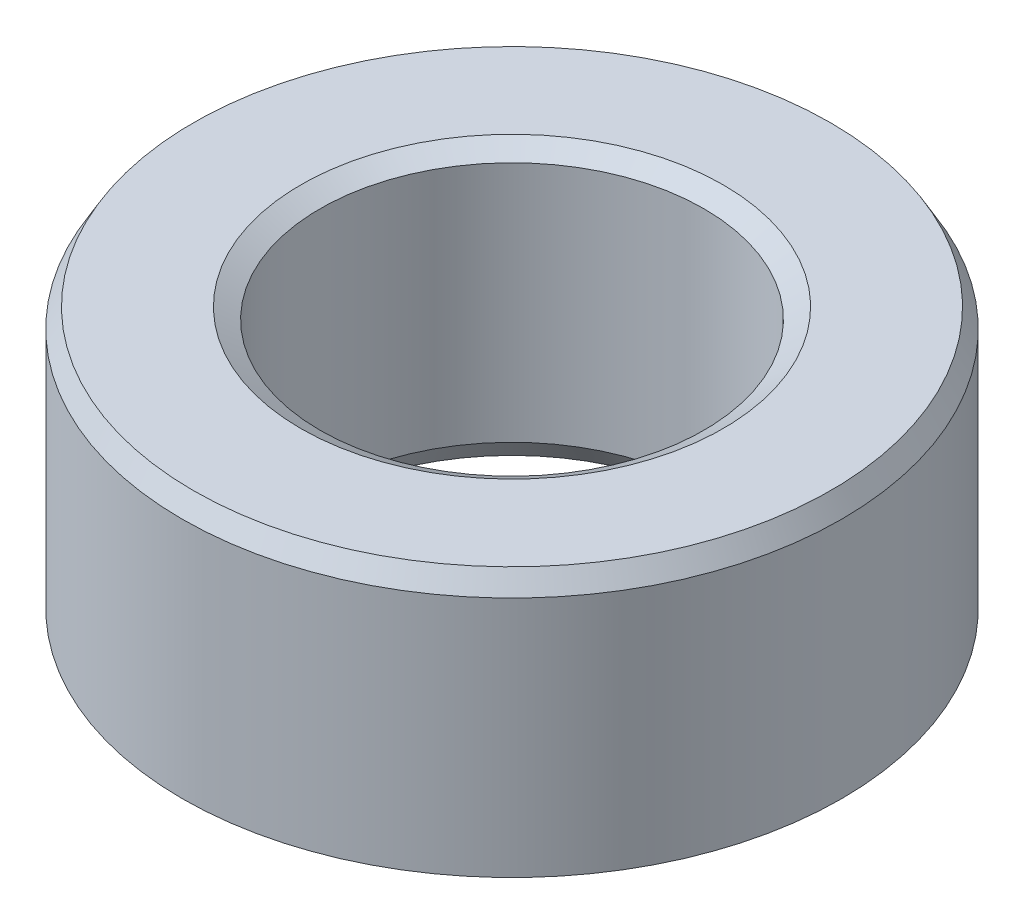
from build123d import *
from OCP.BRepFilletAPI import BRepFilletAPI_MakeChamfer

# Parameters (mm, degrees)
SKETCH1_R           = 50
BOSS_EXTRUDE1_DEPTH = 41.305751496
SKETCH2_R           = 29.108593959
CUT_EXTRUDE1_DEPTH  = 82.891178442
CHAMFER1_SIZE       = 2.914294812
CHAMFER1_SIZE2      = 1.682568894


with BuildPart() as part:
    # Sketch1 → Boss-Extrude1 (new body)
    with BuildSketch(Plane(origin=(0, 0, 0), x_dir=(1, 0, 0), z_dir=(0, 1, 0))):
        Circle(SKETCH1_R)
    extrude(amount=BOSS_EXTRUDE1_DEPTH)

    # Sketch2 → Cut-Extrude1 (cut, through all)
    with BuildSketch(Plane(origin=(0, 0, 0), x_dir=(1, 0, 0), z_dir=(0, 1, 0))):
        Circle(SKETCH2_R)
    extrude(amount=CUT_EXTRUDE1_DEPTH, mode=Mode.SUBTRACT)

    # Chamfer1: one chamfer whose edges measure the first distance from different faces: ONE call of the kernel's chamfer builder (chamfer() names one face for all edges)
    chamfer1_edges_1 = [part.edges().sort_by_distance(p)[0] for p in [
        (-29.108593959, 41.305751496, 0),
    ]]
    chamfer1_side_1 = [part.faces().sort_by_distance(p)[0] for p in [
        (-48.585786438, 41.305751496, 0),
    ]]
    chamfer1_edges_2 = [part.edges().sort_by_distance(p)[0] for p in [
        (-29.108593959, 0, 0),
    ]]
    chamfer1_side_2 = [part.faces().sort_by_distance(p)[0] for p in [
        (-29.108593959, 20.652875748, 0),
    ]]
    chamfer1_edges_3 = [part.edges().sort_by_distance(p)[0] for p in [
        (-50, 0, 0),
    ]]
    chamfer1_side_3 = [part.faces().sort_by_distance(p)[0] for p in [
        (-48.585786438, 0, 0),
    ]]
    chamfer1_edges_4 = [part.edges().sort_by_distance(p)[0] for p in [
        (-50, 41.305751496, 0),
    ]]
    chamfer1_side_4 = [part.faces().sort_by_distance(p)[0] for p in [
        (-50, 20.652875748, 0),
    ]]
    chamfer1 = BRepFilletAPI_MakeChamfer(part.part.solid().wrapped)
    for e in chamfer1_edges_1:
        chamfer1.Add(CHAMFER1_SIZE, CHAMFER1_SIZE2, e.wrapped, chamfer1_side_1[0].wrapped)  # the first distance lies on this face
    for e in chamfer1_edges_2:
        chamfer1.Add(CHAMFER1_SIZE, CHAMFER1_SIZE2, e.wrapped, chamfer1_side_2[0].wrapped)  # the first distance lies on this face
    for e in chamfer1_edges_3:
        chamfer1.Add(CHAMFER1_SIZE, CHAMFER1_SIZE2, e.wrapped, chamfer1_side_3[0].wrapped)  # the first distance lies on this face
    for e in chamfer1_edges_4:
        chamfer1.Add(CHAMFER1_SIZE, CHAMFER1_SIZE2, e.wrapped, chamfer1_side_4[0].wrapped)  # the first distance lies on this face
    add(Compound.cast(chamfer1.Shape()), mode=Mode.REPLACE)


solid = part.part
